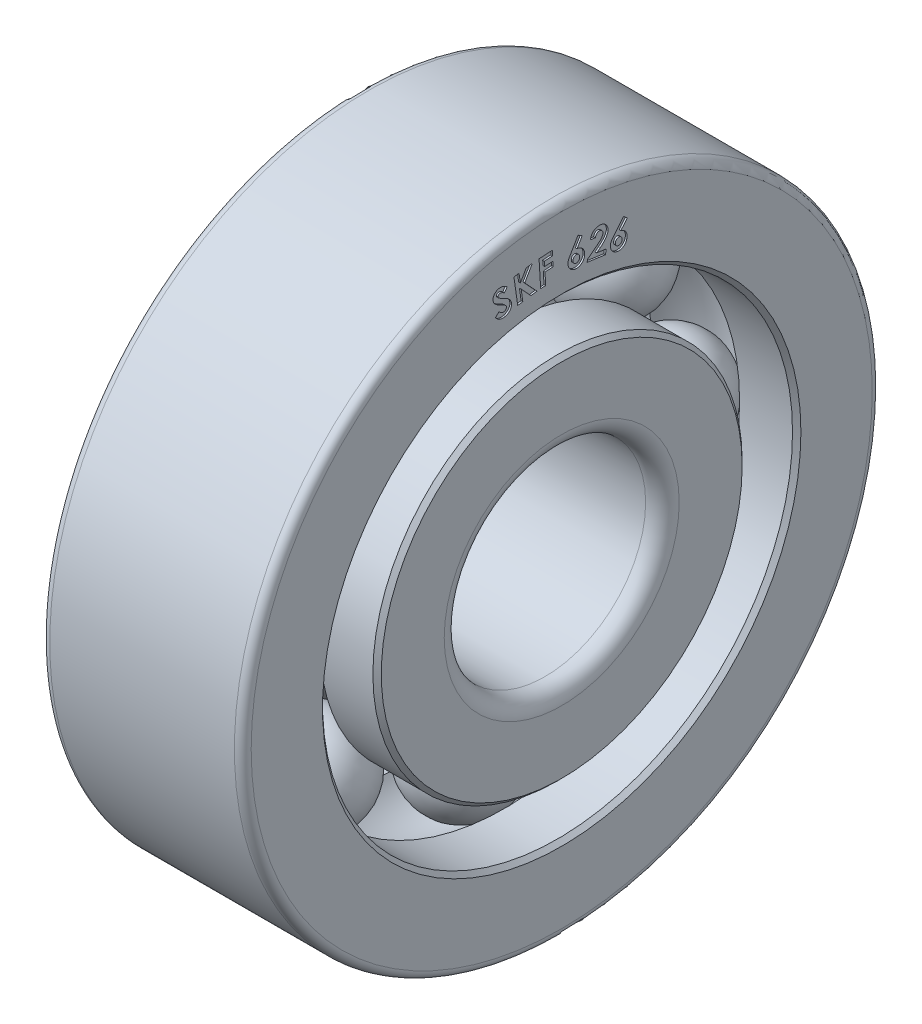
from build123d import *

# Parameters (mm, degrees)
CIRPATTERN2_COUNT = 8
WRAP1_START       = -0.05
WRAP1_DEPTH       = 0.05


# Read off the part's stored shape, not the designer's step: Wrap1
with BuildPart() as part:
    # Sketch1 → Revolve1 (revolve)
    with BuildSketch(Plane.XY, mode=Mode.PRIVATE) as revolve1_sk:
        with BuildLine():
            Line((-5.875, 5.5), (-4.299038106, 5.5))
            ThreePointArc((-4.299038106, 5.5), (-3, 4.75), (-1.700961894, 5.5))
            Line((-1.700961894, 5.5), (-0.125, 5.5))
            Line((-0.125, 5.5), (0, 5.375))
            Line((0, 5.375), (0, 3.5))
            ThreePointArc((0, 3.5), (-0.146446609, 3.146446609), (-0.5, 3))
            Line((-0.5, 3), (-5.5, 3))
            ThreePointArc((-5.5, 3), (-5.853553391, 3.146446609), (-6, 3.5))
            Line((-6, 3.5), (-6, 5.375))
            Line((-6, 5.375), (-5.875, 5.5))
        make_face()
        with BuildLine():
            Line((-0.25, 9.5), (-5.75, 9.5))
            ThreePointArc((-5.75, 9.5), (-5.926776695, 9.426776695), (-6, 9.25))
            Line((-6, 9.25), (-6, 7.125))
            Line((-6, 7.125), (-5.875, 7))
            Line((-5.875, 7), (-4.299038106, 7))
            ThreePointArc((-4.299038106, 7), (-3, 7.75), (-1.700961894, 7))
            Line((-1.700961894, 7), (-0.125, 7))
            Line((-0.125, 7), (0, 7.125))
            Line((0, 7.125), (0, 9.25))
            ThreePointArc((0, 9.25), (-0.073223305, 9.426776695), (-0.25, 9.5))
        make_face()
    revolve(revolve1_sk.sketch.rotate(Axis((0, 0, 0), (-1, 0, 0)), 90), axis=Axis((0, 0, 0), (-1, 0, 0)))

    # Wrap1 outline → Wrap1 (cut)
    # profile 1 of 6: a face of its own
    with BuildSketch(Plane(origin=(0, 0, 0), x_dir=(0, 0, -1), z_dir=(1, 0, 0)).offset(WRAP1_START)):
        with BuildLine():
            add(Edge.make_bspline(
                [(1.759451654, 7.878047553), (1.767456237, 7.876009312), (1.783214619, 7.871996688), (1.805792313, 7.863431175), (1.826888574, 7.852751245), (1.846673566, 7.840301229), (1.864943624, 7.825682011), (1.881849984, 7.809129742), (1.897221692, 7.790428382), (1.911087649, 7.770056312), (1.922971706, 7.748399656), (1.932931888, 7.726066909), (1.940148731, 7.702980972), (1.944913784, 7.679291722), (1.947601462, 7.655037848), (1.947401916, 7.630193955), (1.945363646, 7.604777305), (1.941847034, 7.587902066), (1.940060628, 7.579329604)],
                knots=[0, 0, 0, 0, 0.063628939, 0.12526439, 0.185660671, 0.245628784, 0.305108674, 0.365668937, 0.427665021, 0.491388473, 0.555335004, 0.617834919, 0.679559695, 0.741332517, 0.803852771, 0.867260188, 0.932569432, 1, 1, 1, 1], degree=3))
            Line((1.759451654, 7.878047553), (1.95384268, 8.110579604))
            Line((1.95384268, 8.110579604), (1.842784987, 8.201284733))
            Line((1.842784987, 8.201284733), (1.556246526, 7.857053963))
            add(Edge.make_bspline(
                [(1.454323449, 7.687182169), (1.455772209, 7.693140455), (1.458678673, 7.70509381), (1.464904852, 7.72263858), (1.472435974, 7.739916901), (1.479880225, 7.754256548), (1.486899155, 7.766220449), (1.493448917, 7.77616438), (1.501106835, 7.787211921), (1.5097997, 7.799287093), (1.519867721, 7.812277564), (1.530852422, 7.8264292), (1.543229627, 7.841379188), (1.551811477, 7.851713337), (1.556246526, 7.857053963)],
                knots=[0, 0, 0, 0, 0.091831696, 0.18423027, 0.278509679, 0.3740984, 0.426127344, 0.486294002, 0.552460381, 0.627553072, 0.709202417, 0.798712819, 0.895975981, 1, 1, 1, 1], degree=3))
            add(Edge.make_bspline(
                [(1.644387552, 7.39247063), (1.635893671, 7.394592038), (1.619191541, 7.398763515), (1.595385072, 7.407955603), (1.572996737, 7.41872791), (1.552332504, 7.431841464), (1.533351688, 7.446980404), (1.515926624, 7.464131597), (1.499967987, 7.483215666), (1.486093956, 7.504308961), (1.473981868, 7.526320435), (1.464183077, 7.548874876), (1.456526953, 7.571526766), (1.451429447, 7.594417079), (1.448440481, 7.617435462), (1.448068335, 7.640626687), (1.449674181, 7.664010152), (1.452763594, 7.67940783), (1.454323449, 7.687182169)],
                knots=[0, 0, 0, 0, 0.067356912, 0.132448764, 0.196101472, 0.258410861, 0.32046855, 0.382716808, 0.446392107, 0.511650116, 0.576816012, 0.639633859, 0.700771309, 0.760647539, 0.819934485, 0.87918146, 0.938998315, 1, 1, 1, 1], degree=3))
            add(Edge.make_bspline(
                [(1.940060628, 7.579329604), (1.937974265, 7.571108735), (1.933865552, 7.554919227), (1.925071763, 7.531767052), (1.914572648, 7.509983377), (1.901722668, 7.489802033), (1.887017284, 7.471006069), (1.870131886, 7.453802424), (1.85154375, 7.43779732), (1.830960455, 7.423769274), (1.809350992, 7.411440272), (1.786972103, 7.401437604), (1.764151799, 7.393881122), (1.740958511, 7.388694595), (1.717325721, 7.386010321), (1.693282377, 7.385472296), (1.668782009, 7.387544607), (1.652588368, 7.390814622), (1.644387552, 7.39247063)],
                knots=[0, 0, 0, 0, 0.065304486, 0.128605324, 0.190456379, 0.251320337, 0.312582426, 0.373999182, 0.436769217, 0.501276298, 0.565603226, 0.628248985, 0.689814517, 0.750530771, 0.811030393, 0.872782763, 0.935574386, 1, 1, 1, 1], degree=3))
        make_face()
        with BuildLine():
            add(Edge.make_bspline(
                [(1.599195244, 7.658496271), (1.597870484, 7.651202037), (1.595298768, 7.637041953), (1.596676001, 7.615686092), (1.60156314, 7.595252116), (1.610839778, 7.576433856), (1.622711396, 7.559588059), (1.63749666, 7.546286332), (1.654082947, 7.535963406), (1.666490534, 7.532513275), (1.672752936, 7.530771912)],
                knots=[0, 0, 0, 0, 0.135523526, 0.263087855, 0.389278756, 0.518566272, 0.645572429, 0.764872283, 0.881325486, 1, 1, 1, 1], degree=3))
            add(Edge.make_bspline(
                [(1.719547808, 7.74070781), (1.712893119, 7.741844018), (1.699831173, 7.744074189), (1.680032218, 7.742553316), (1.661148825, 7.736693632), (1.643494686, 7.727122914), (1.627758208, 7.714113149), (1.614701054, 7.698173606), (1.604895781, 7.679372106), (1.601130936, 7.665584933), (1.599195244, 7.658496271)],
                knots=[0, 0, 0, 0, 0.124235, 0.243850773, 0.362356398, 0.486747757, 0.612088683, 0.736803861, 0.864677958, 1, 1, 1, 1], degree=3))
            add(Edge.make_bspline(
                [(1.796470885, 7.613944989), (1.797771987, 7.621183987), (1.800306139, 7.635283354), (1.799241223, 7.656505101), (1.794229616, 7.676630203), (1.785154301, 7.695191181), (1.772966463, 7.711680167), (1.757714863, 7.725156385), (1.739718989, 7.735219676), (1.726382087, 7.738848353), (1.719547808, 7.74070781)],
                knots=[0, 0, 0, 0, 0.132846275, 0.25874418, 0.381457329, 0.50607007, 0.630479865, 0.750427695, 0.872110733, 1, 1, 1, 1], degree=3))
            add(Edge.make_bspline(
                [(1.672752936, 7.530771912), (1.679463014, 7.529629068), (1.692635909, 7.527385494), (1.712653452, 7.529009179), (1.7320076, 7.534592617), (1.750273488, 7.544233496), (1.76675121, 7.557247216), (1.780325898, 7.573482657), (1.790697919, 7.592546522), (1.794511473, 7.6066821), (1.796470885, 7.613944989)],
                knots=[0, 0, 0, 0, 0.122596952, 0.240676296, 0.359208467, 0.484410996, 0.611489601, 0.736188821, 0.864453277, 1, 1, 1, 1], degree=3))
        make_face(mode=Mode.SUBTRACT)
    # profile 2 of 6: a face of its own
    with BuildSketch(Plane(origin=(0, 0, 0), x_dir=(0, 0, -1), z_dir=(1, 0, 0)).offset(WRAP1_START)):
        with BuildLine():
            add(Edge.make_bspline(
                [(0.854276442, 8.092509194), (0.856410428, 8.102752282), (0.860585519, 8.12279263), (0.869458753, 8.151523076), (0.880185403, 8.178300957), (0.892905757, 8.203049681), (0.907296927, 8.225956167), (0.923726648, 8.24675999), (0.942143101, 8.265463122), (0.96229424, 8.282098124), (0.983917072, 8.296474977), (1.006575197, 8.308617402), (1.030349662, 8.318105583), (1.055041161, 8.325183583), (1.080777845, 8.329664541), (1.107438306, 8.331674077), (1.135132326, 8.331474909), (1.15375598, 8.329230417), (1.163250801, 8.328086117)],
                knots=[0, 0, 0, 0, 0.07216084, 0.141180892, 0.207160892, 0.270955112, 0.332920472, 0.393534852, 0.45348102, 0.513698521, 0.57350061, 0.632365095, 0.69074757, 0.749780289, 0.809286327, 0.870657998, 0.934058103, 1, 1, 1, 1], degree=3))
            Line((0.854276442, 8.092509194), (1.000590545, 8.071836117))
            add(Edge.make_bspline(
                [(1.133923878, 8.18914381), (1.129976645, 8.18961132), (1.122205561, 8.190531727), (1.110593807, 8.190283273), (1.099325189, 8.189013692), (1.088377823, 8.186668189), (1.077810382, 8.182870695), (1.06759863, 8.17793185), (1.057765956, 8.171741647), (1.048294822, 8.164591091), (1.039514897, 8.156187081), (1.031339495, 8.146967996), (1.024076566, 8.136739076), (1.017622004, 8.125591302), (1.012034399, 8.113466144), (1.007496321, 8.100372931), (1.003299139, 8.086525914), (1.001510733, 8.076826669), (1.000590545, 8.071836117)],
                knots=[0, 0, 0, 0, 0.060096578, 0.118314671, 0.175278541, 0.231578709, 0.287324642, 0.344819642, 0.402925345, 0.4629185, 0.524114496, 0.586558224, 0.649153559, 0.713636717, 0.781286069, 0.850845839, 0.923255724, 1, 1, 1, 1], degree=3))
            add(Edge.make_bspline(
                [(1.227513621, 8.068951502), (1.228184875, 8.076322381), (1.229484059, 8.090588421), (1.226465974, 8.111687643), (1.219319663, 8.131239885), (1.208132616, 8.148841534), (1.193849295, 8.164234881), (1.176467201, 8.176419564), (1.156158579, 8.184946902), (1.141529107, 8.187708286), (1.133923878, 8.18914381)],
                knots=[0, 0, 0, 0, 0.129857538, 0.25133405, 0.371450626, 0.493482068, 0.615820717, 0.738620533, 0.864120117, 1, 1, 1, 1], degree=3))
            add(Edge.make_bspline(
                [(1.046584134, 7.847316886), (1.054666299, 7.853599802), (1.070276882, 7.865735163), (1.092601144, 7.883621981), (1.11281371, 7.900821537), (1.131115744, 7.917088392), (1.147336531, 7.932674324), (1.161592771, 7.947340901), (1.173879157, 7.961161146), (1.187288383, 7.978091292), (1.20082031, 7.998538191), (1.213673897, 8.022585772), (1.223112528, 8.045798263), (1.226089985, 8.061462048), (1.227513621, 8.068951502)],
                knots=[0, 0, 0, 0, 0.104888376, 0.202590368, 0.293064942, 0.376789794, 0.453435045, 0.523494973, 0.586311268, 0.642813284, 0.744671903, 0.836977179, 0.922052562, 1, 1, 1, 1], degree=3))
            Line((1.046584134, 7.847316886), (0.76773798, 7.63289381))
            Line((0.76773798, 7.63289381), (0.757641827, 7.561098938))
            Line((0.757641827, 7.561098938), (1.303635416, 7.484336117))
            Line((1.303635416, 7.484336117), (1.323186698, 7.623118168))
            Line((1.323186698, 7.623118168), (1.042417468, 7.662701502))
            Line((1.042417468, 7.662701502), (1.144020032, 7.743470733))
            add(Edge.make_bspline(
                [(1.377994391, 8.059816886), (1.376993285, 8.053927932), (1.374969287, 8.04202186), (1.370625647, 8.02410998), (1.364789861, 8.006126897), (1.357933924, 7.987873146), (1.349511428, 7.969628121), (1.33988991, 7.951173022), (1.328941648, 7.932585672), (1.316729101, 7.913664715), (1.302627903, 7.894481912), (1.286517091, 7.874657135), (1.268109168, 7.854341375), (1.247682159, 7.833179786), (1.22487594, 7.811679626), (1.200011016, 7.789355341), (1.172913502, 7.766430993), (1.15383727, 7.751272023), (1.144020032, 7.743470733)],
                knots=[0, 0, 0, 0, 0.044450552, 0.089868489, 0.13701961, 0.185088725, 0.234905083, 0.286475386, 0.339934452, 0.395403326, 0.454010667, 0.517035217, 0.58544749, 0.657987739, 0.735885604, 0.818660122, 0.906676704, 1, 1, 1, 1], degree=3))
            add(Edge.make_bspline(
                [(1.163250801, 8.328086117), (1.174853771, 8.326126723), (1.197529512, 8.322297468), (1.229780593, 8.311880346), (1.259423195, 8.298100652), (1.286119125, 8.280639181), (1.310055872, 8.2602272), (1.330783873, 8.236621133), (1.348017848, 8.209803967), (1.361846049, 8.18067026), (1.37226801, 8.150348079), (1.378583956, 8.119829449), (1.380968155, 8.089545264), (1.378982103, 8.069690937), (1.377994391, 8.059816886)],
                knots=[0, 0, 0, 0, 0.092156886, 0.180102664, 0.264785891, 0.347726877, 0.429403109, 0.510720994, 0.593082626, 0.678503117, 0.763000764, 0.843823192, 0.922329385, 1, 1, 1, 1], degree=3))
        make_face()
    # profile 3 of 6: a face of its own
    with BuildSketch(Plane(origin=(0, 0, 0), x_dir=(0, 0, -1), z_dir=(1, 0, 0)).offset(WRAP1_START)):
        with BuildLine():
            add(Edge.make_bspline(
                [(0.456488424, 8.062377274), (0.464734142, 8.061674883), (0.48101178, 8.060288311), (0.504806963, 8.055593582), (0.527537307, 8.048709657), (0.549168876, 8.039482048), (0.569760664, 8.028077752), (0.589250494, 8.014365298), (0.607538763, 7.998398634), (0.624589511, 7.980530609), (0.640036061, 7.96114985), (0.653477499, 7.940523537), (0.664490113, 7.918838269), (0.673477671, 7.89624373), (0.679797341, 7.872613398), (0.683986169, 7.848047806), (0.685970023, 7.822501537), (0.685442568, 7.805167279), (0.685174321, 7.796351633)],
                knots=[0, 0, 0, 0, 0.063447643, 0.125250183, 0.185658011, 0.245331646, 0.305314037, 0.365910605, 0.427783752, 0.491259179, 0.555130211, 0.617645975, 0.679775074, 0.741414368, 0.803844114, 0.867037159, 0.932379372, 1, 1, 1, 1], degree=3))
            Line((0.456488424, 8.062377274), (0.610494834, 8.325197787))
            Line((0.610494834, 8.325197787), (0.485494834, 8.396832402))
            Line((0.485494834, 8.396832402), (0.258571757, 8.007890095))
            add(Edge.make_bspline(
                [(0.185815347, 7.822633685), (0.186318404, 7.828786169), (0.187329021, 7.841146213), (0.190392298, 7.859588011), (0.194943563, 7.877943942), (0.19987281, 7.893371372), (0.205059749, 7.906271933), (0.209617355, 7.917367501), (0.215474015, 7.929492417), (0.222234792, 7.942833802), (0.229943893, 7.957410919), (0.238568564, 7.973240776), (0.248189822, 7.990227527), (0.255029367, 8.001863502), (0.258571757, 8.007890095)],
                knots=[0, 0, 0, 0, 0.092039995, 0.184903876, 0.278428428, 0.373917537, 0.426143169, 0.485774236, 0.552773827, 0.626885118, 0.708853518, 0.798698404, 0.895740337, 1, 1, 1, 1], degree=3))
            add(Edge.make_bspline(
                [(0.422994834, 7.561896505), (0.414214561, 7.562648615), (0.396974613, 7.564125373), (0.371781508, 7.568984025), (0.347830671, 7.576112176), (0.3252679, 7.585918889), (0.303827414, 7.597590583), (0.283645304, 7.611631807), (0.264860133, 7.628092014), (0.247560071, 7.646574995), (0.23203403, 7.666418897), (0.218452205, 7.687015122), (0.207107845, 7.708214321), (0.198366427, 7.730146305), (0.191491604, 7.752460676), (0.18716143, 7.77540633), (0.185229507, 7.798883821), (0.185618964, 7.814672341), (0.185815347, 7.822633685)],
                knots=[0, 0, 0, 0, 0.06747911, 0.132494315, 0.19619521, 0.258532608, 0.320625011, 0.382954347, 0.446480144, 0.511625321, 0.576631509, 0.639290512, 0.700439698, 0.760479037, 0.819907087, 0.879063942, 0.939018132, 1, 1, 1, 1], degree=3))
            add(Edge.make_bspline(
                [(0.685174321, 7.796351633), (0.684492469, 7.787836088), (0.683153731, 7.771116821), (0.678204139, 7.746699457), (0.671177395, 7.723465204), (0.6620041, 7.701227055), (0.650369862, 7.680251266), (0.636700903, 7.660232712), (0.62072137, 7.641414951), (0.602747249, 7.623985071), (0.583318421, 7.608159366), (0.56281917, 7.594516513), (0.541496041, 7.5832182), (0.519421051, 7.574112234), (0.49638854, 7.567584742), (0.472615553, 7.563293311), (0.448032446, 7.561049113), (0.431437913, 7.561610751), (0.422994834, 7.561896505)],
                knots=[0, 0, 0, 0, 0.065428564, 0.128461246, 0.190502112, 0.251255623, 0.312458612, 0.374011194, 0.436762672, 0.501329821, 0.565657668, 0.628567894, 0.689742116, 0.750339529, 0.811247363, 0.872843505, 0.935304462, 1, 1, 1, 1], degree=3))
        make_face()
        with BuildLine():
            add(Edge.make_bspline(
                [(0.334212783, 7.818146505), (0.334141345, 7.810753395), (0.334001603, 7.796291379), (0.338630879, 7.775285542), (0.347179283, 7.75592824), (0.359268378, 7.738678076), (0.374012683, 7.724160459), (0.390635214, 7.713153664), (0.408833641, 7.705892124), (0.421649601, 7.704451233), (0.428123039, 7.703723428)],
                knots=[0, 0, 0, 0, 0.134746447, 0.263583941, 0.389440509, 0.519132851, 0.646127188, 0.765236844, 0.881419367, 1, 1, 1, 1], degree=3))
            add(Edge.make_bspline(
                [(0.439821757, 7.919588813), (0.433012049, 7.919608225), (0.419691978, 7.919646197), (0.400290749, 7.91480505), (0.382495985, 7.905905528), (0.36656218, 7.893401348), (0.353094919, 7.877932338), (0.342988654, 7.859939402), (0.336398422, 7.839771915), (0.334957428, 7.825514261), (0.334212783, 7.818146505)],
                knots=[0, 0, 0, 0, 0.124690271, 0.243899329, 0.363237497, 0.487657315, 0.613542145, 0.737419285, 0.864309321, 1, 1, 1, 1], degree=3))
            add(Edge.make_bspline(
                [(0.536937142, 7.8067683), (0.536996148, 7.814159052), (0.537111065, 7.828552902), (0.532715045, 7.849412972), (0.524327776, 7.868483707), (0.512295025, 7.885338662), (0.497479836, 7.899675562), (0.480188073, 7.91045737), (0.460717843, 7.917475454), (0.44693121, 7.918869787), (0.439821757, 7.919588813)],
                knots=[0, 0, 0, 0, 0.133049271, 0.259119961, 0.381238965, 0.506377976, 0.630432414, 0.750770185, 0.871477849, 1, 1, 1, 1], degree=3))
            add(Edge.make_bspline(
                [(0.428123039, 7.703723428), (0.434991661, 7.703683225), (0.448440732, 7.703604506), (0.468023272, 7.708773365), (0.486266397, 7.717563899), (0.502830411, 7.730106387), (0.51714134, 7.745597285), (0.527658078, 7.764045264), (0.53486977, 7.784584274), (0.53623451, 7.799228682), (0.536937142, 7.8067683)],
                knots=[0, 0, 0, 0, 0.122998707, 0.240836987, 0.360225965, 0.485051329, 0.6121639, 0.736504533, 0.864340367, 1, 1, 1, 1], degree=3))
        make_face(mode=Mode.SUBTRACT)
    # profile 4 of 6: a face of its own
    with BuildSketch(Plane(origin=(0, 0, 0), x_dir=(0, 0, -1), z_dir=(1, 0, 0)).offset(WRAP1_START)):
        with BuildLine():
            add(Edge.make_bspline(
                [(-1.709010615, 8.002365382), (-1.715129781, 8.007590236), (-1.726932219, 8.017667754), (-1.745171218, 8.030625686), (-1.762900161, 8.04115707), (-1.780036912, 8.0493871), (-1.796842928, 8.054678447), (-1.813089585, 8.057731413), (-1.828925396, 8.058174766), (-1.83910127, 8.056429168), (-1.844106769, 8.055570511)],
                knots=[0, 0, 0, 0, 0.160195847, 0.308980266, 0.444915779, 0.570570229, 0.686653874, 0.794755029, 0.899040267, 1, 1, 1, 1], degree=3))
            Line((-1.709010615, 8.002365382), (-1.622311897, 8.123358972))
            add(Edge.make_bspline(
                [(-1.874234974, 8.196916665), (-1.864600577, 8.198839165), (-1.845460783, 8.202658425), (-1.816190401, 8.203652305), (-1.786917047, 8.201711753), (-1.76257071, 8.196746997), (-1.742741046, 8.191086399), (-1.727252644, 8.185246158), (-1.711172053, 8.178141061), (-1.694501419, 8.169770666), (-1.677221156, 8.160165452), (-1.659362438, 8.14920703), (-1.640962385, 8.136849284), (-1.628641867, 8.12793758), (-1.622311897, 8.123358972)],
                knots=[0, 0, 0, 0, 0.10827595, 0.215102132, 0.322099035, 0.431489829, 0.488589086, 0.549594541, 0.614012172, 0.682571047, 0.755417687, 0.832170822, 0.913773626, 1, 1, 1, 1], degree=3))
            add(Edge.make_bspline(
                [(-2.041863179, 7.952846152), (-2.04316336, 7.959503855), (-2.045727711, 7.972634859), (-2.047368589, 7.992456605), (-2.046711045, 8.011968431), (-2.043912155, 8.031178432), (-2.039286483, 8.050155276), (-2.032530184, 8.068886486), (-2.023413965, 8.087144835), (-2.012588236, 8.105037951), (-2.00005245, 8.122000469), (-1.986120958, 8.137702744), (-1.970553374, 8.151494543), (-1.953894675, 8.163859905), (-1.935954515, 8.174723166), (-1.916609602, 8.183844466), (-1.895952033, 8.191411713), (-1.881536991, 8.195065712), (-1.874234974, 8.196916665)],
                knots=[0, 0, 0, 0, 0.061706444, 0.121703774, 0.180563573, 0.239006258, 0.298082513, 0.358062111, 0.419812591, 0.483515034, 0.548178674, 0.611527635, 0.674190059, 0.737102829, 0.800137586, 0.864726248, 0.931476346, 1, 1, 1, 1], degree=3))
            add(Edge.make_bspline(
                [(-1.780164461, 7.727685895), (-1.792156403, 7.733671184), (-1.815181279, 7.745163111), (-1.84791089, 7.762518937), (-1.877594362, 7.778979461), (-1.904144367, 7.794649176), (-1.927642831, 7.809320442), (-1.947895803, 7.823292338), (-1.965136959, 7.836308217), (-1.983459467, 7.852520138), (-2.002219385, 7.872839001), (-2.020200564, 7.89837137), (-2.034086158, 7.924859241), (-2.039292263, 7.943594283), (-2.041863179, 7.952846152)],
                knots=[0, 0, 0, 0, 0.112719796, 0.216425271, 0.311556546, 0.39816443, 0.475696597, 0.544489667, 0.605056225, 0.657254276, 0.750098278, 0.836851707, 0.919432973, 1, 1, 1, 1], degree=3))
            add(Edge.make_bspline(
                [(-1.644587538, 7.618711536), (-1.645824373, 7.623042433), (-1.648343864, 7.631864673), (-1.655141118, 7.644354731), (-1.664492246, 7.656103974), (-1.67413819, 7.665447711), (-1.68356716, 7.672953611), (-1.692488637, 7.679203036), (-1.703014208, 7.686050988), (-1.715218675, 7.693393394), (-1.729036334, 7.701288951), (-1.744613179, 7.709522764), (-1.761741968, 7.718586113), (-1.773845457, 7.724564626), (-1.780164461, 7.727685895)],
                knots=[0, 0, 0, 0, 0.075187645, 0.153160762, 0.235944607, 0.325701743, 0.377211205, 0.437476499, 0.507884735, 0.587289417, 0.675760048, 0.774133617, 0.882079426, 1, 1, 1, 1], degree=3))
            add(Edge.make_bspline(
                [(-1.717183692, 7.525121793), (-1.711131387, 7.526794238), (-1.699427753, 7.530028327), (-1.68335062, 7.53804319), (-1.669571263, 7.54857817), (-1.658244698, 7.561241278), (-1.649572457, 7.575101502), (-1.644310802, 7.589627569), (-1.642262849, 7.60436399), (-1.643810133, 7.613913538), (-1.644587538, 7.618711536)],
                knots=[0, 0, 0, 0, 0.143416428, 0.277331291, 0.408114034, 0.537933778, 0.664124174, 0.779718861, 0.889323701, 1, 1, 1, 1], degree=3))
            add(Edge.make_bspline(
                [(-1.868786256, 7.598198716), (-1.86234237, 7.591127276), (-1.85005872, 7.577647353), (-1.830410753, 7.560254852), (-1.811319993, 7.54572552), (-1.792033216, 7.534905428), (-1.773075348, 7.527064836), (-1.754141002, 7.523136871), (-1.735398942, 7.521775093), (-1.723254755, 7.524006352), (-1.717183692, 7.525121793)],
                knots=[0, 0, 0, 0, 0.162243303, 0.309276108, 0.444717657, 0.568521608, 0.683668616, 0.791243736, 0.895639584, 1, 1, 1, 1], degree=3))
            Line((-1.868786256, 7.598198716), (-1.975356769, 7.4953141))
            add(Edge.make_bspline(
                [(-1.688177281, 7.384576921), (-1.694997791, 7.383141129), (-1.708408771, 7.380317972), (-1.7285595, 7.377860728), (-1.748305313, 7.376414904), (-1.76769707, 7.376854413), (-1.786719015, 7.378380264), (-1.805364592, 7.381456798), (-1.823646964, 7.385922072), (-1.841531256, 7.391912103), (-1.859124527, 7.399318507), (-1.876462376, 7.408358225), (-1.893632578, 7.418920946), (-1.910438777, 7.431225817), (-1.92717733, 7.444811913), (-1.943515303, 7.460162618), (-1.959758367, 7.476982582), (-1.970079901, 7.489112632), (-1.975356769, 7.4953141)],
                knots=[0, 0, 0, 0, 0.06398805, 0.125817931, 0.18629368, 0.245668755, 0.303771338, 0.361443517, 0.419038426, 0.476444944, 0.534491568, 0.594180024, 0.655861781, 0.719457379, 0.785358042, 0.853746799, 0.925228284, 1, 1, 1, 1], degree=3))
            add(Edge.make_bspline(
                [(-1.501318307, 7.658134613), (-1.499704352, 7.650307748), (-1.496540763, 7.634965942), (-1.49478933, 7.611854658), (-1.49478528, 7.589367584), (-1.497365223, 7.567424498), (-1.502415678, 7.546116787), (-1.509671629, 7.525335022), (-1.519172016, 7.505090933), (-1.530834346, 7.485570476), (-1.544585042, 7.467254656), (-1.559981192, 7.450333453), (-1.577134214, 7.435152288), (-1.595992261, 7.42164071), (-1.616619397, 7.409760794), (-1.638931925, 7.399519247), (-1.662919162, 7.390976106), (-1.67964452, 7.38673871), (-1.688177281, 7.384576921)],
                knots=[0, 0, 0, 0, 0.064457205, 0.126345589, 0.18672494, 0.245782177, 0.304258647, 0.363180305, 0.423182668, 0.484497384, 0.546427827, 0.607784996, 0.66888548, 0.731001847, 0.794765679, 0.860761275, 0.928964699, 1, 1, 1, 1], degree=3))
            add(Edge.make_bspline(
                [(-1.623754204, 7.815987177), (-1.615055862, 7.810248196), (-1.598359643, 7.799232386), (-1.575899679, 7.781207039), (-1.556595747, 7.763127815), (-1.540570061, 7.744421514), (-1.52740719, 7.724760631), (-1.516211457, 7.704088346), (-1.507518518, 7.681696634), (-1.503410681, 7.666086047), (-1.501318307, 7.658134613)],
                knots=[0, 0, 0, 0, 0.152029297, 0.291815878, 0.419763936, 0.537567645, 0.650448819, 0.764511271, 0.880051091, 1, 1, 1, 1], degree=3))
            add(Edge.make_bspline(
                [(-1.746190102, 7.881532049), (-1.738220828, 7.877491402), (-1.723048475, 7.869798588), (-1.701677467, 7.858589783), (-1.682748451, 7.848588749), (-1.666135749, 7.840026901), (-1.652128745, 7.832262768), (-1.640404651, 7.825941736), (-1.631207916, 7.820657988), (-1.625990295, 7.817388406), (-1.623754204, 7.815987177)],
                knots=[0, 0, 0, 0, 0.19297103, 0.367389173, 0.521173054, 0.655344525, 0.770990723, 0.867025122, 0.943011601, 1, 1, 1, 1], degree=3))
            add(Edge.make_bspline(
                [(-1.876799076, 7.956211536), (-1.874471195, 7.954416845), (-1.8690559, 7.950241898), (-1.859136178, 7.943966212), (-1.846789113, 7.936304021), (-1.83170532, 7.927658946), (-1.814127411, 7.917684674), (-1.793736228, 7.906739097), (-1.770915735, 7.894325253), (-1.7547, 7.885935126), (-1.746190102, 7.881532049)],
                knots=[0, 0, 0, 0, 0.058532544, 0.136162857, 0.233631275, 0.348079095, 0.482458698, 0.636275553, 0.809120083, 1, 1, 1, 1], degree=3))
            add(Edge.make_bspline(
                [(-1.898273435, 7.990025639), (-1.897373688, 7.986829621), (-1.895571388, 7.98042762), (-1.890769169, 7.971590583), (-1.884565824, 7.96335485), (-1.879445475, 7.958645509), (-1.876799076, 7.956211536)],
                knots=[0, 0, 0, 0, 0.243895421, 0.488551433, 0.735663197, 1, 1, 1, 1], degree=3))
            add(Edge.make_bspline(
                [(-1.844106769, 8.055570511), (-1.848704123, 8.054339123), (-1.857511261, 8.051980156), (-1.869441854, 8.046012142), (-1.879799263, 8.038640828), (-1.887946266, 8.029510087), (-1.894243924, 8.019846162), (-1.898311084, 8.009908932), (-1.899698986, 7.999793664), (-1.89874803, 7.993277615), (-1.898273435, 7.990025639)],
                knots=[0, 0, 0, 0, 0.151629987, 0.290477149, 0.423545373, 0.555162379, 0.678669664, 0.790491532, 0.895440219, 1, 1, 1, 1], degree=3))
        make_face()
    # profile 5 of 6: a face of its own
    with BuildSketch(Plane(origin=(0, 0, 0), x_dir=(0, 0, -1), z_dir=(1, 0, 0)).offset(WRAP1_START)):
        Polygon((-0.271323542, 8.243584017), (-0.280458157, 8.391340427), (-0.675169696, 8.367301966), (-0.626451747, 7.571628889), (-0.47677226, 7.580763504), (-0.498727388, 7.938776325), (-0.253695337, 7.953680171), (-0.262509439, 8.099192992), (-0.507541491, 8.084289145), (-0.516355593, 8.228680171), align=None)
    # profile 6 of 6: a face of its own
    with BuildSketch(Plane(origin=(0, 0, 0), x_dir=(0, 0, -1), z_dir=(1, 0, 0)).offset(WRAP1_START)):
        Polygon((-1.232314482, 8.021412806), (-1.270936276, 8.292566652), (-1.422699097, 8.270932037), (-1.31051961, 7.482630755), (-1.158756789, 7.50426537), (-1.208596533, 7.854105114), (-0.915487558, 7.538880755), (-0.737602943, 7.564201268), (-1.10202602, 7.957791011), (-0.876545251, 8.348656396), (-1.057154225, 8.32301537), align=None)
    extrude(amount=WRAP1_DEPTH, mode=Mode.SUBTRACT)


with BuildPart() as body_2:
    # Sketch2 → Revolve2 (revolve)
    with BuildSketch(Plane.XY):
        with BuildLine():
            Line((-3, 7.75), (-3, 4.75))
            ThreePointArc((-3, 4.75), (-1.5, 6.25), (-3, 7.75))
        make_face()
    revolve(axis=Axis((-3, 7.75, 0), (0, -1, 0)))


with BuildPart() as cirpattern2_1:
    # CirPattern2: pattern copy
    add(body_2.part.rotate(Axis((0, 0, 0), (1, 0, 0)), 1 * 360 / CIRPATTERN2_COUNT))


with BuildPart() as cirpattern2_2:
    # CirPattern2: pattern copy
    add(body_2.part.rotate(Axis((0, 0, 0), (1, 0, 0)), 2 * 360 / CIRPATTERN2_COUNT))


with BuildPart() as cirpattern2_3:
    # CirPattern2: pattern copy
    add(body_2.part.rotate(Axis((0, 0, 0), (1, 0, 0)), 3 * 360 / CIRPATTERN2_COUNT))


with BuildPart() as cirpattern2_4:
    # CirPattern2: pattern copy
    add(body_2.part.rotate(Axis((0, 0, 0), (1, 0, 0)), 4 * 360 / CIRPATTERN2_COUNT))


with BuildPart() as cirpattern2_5:
    # CirPattern2: pattern copy
    add(body_2.part.rotate(Axis((0, 0, 0), (1, 0, 0)), 5 * 360 / CIRPATTERN2_COUNT))


with BuildPart() as cirpattern2_6:
    # CirPattern2: pattern copy
    add(body_2.part.rotate(Axis((0, 0, 0), (1, 0, 0)), 6 * 360 / CIRPATTERN2_COUNT))


with BuildPart() as cirpattern2_7:
    # CirPattern2: pattern copy
    add(body_2.part.rotate(Axis((0, 0, 0), (1, 0, 0)), 7 * 360 / CIRPATTERN2_COUNT))


solid = Compound([part.part, body_2.part, cirpattern2_1.part, cirpattern2_2.part, cirpattern2_3.part, cirpattern2_4.part, cirpattern2_5.part, cirpattern2_6.part, cirpattern2_7.part])
